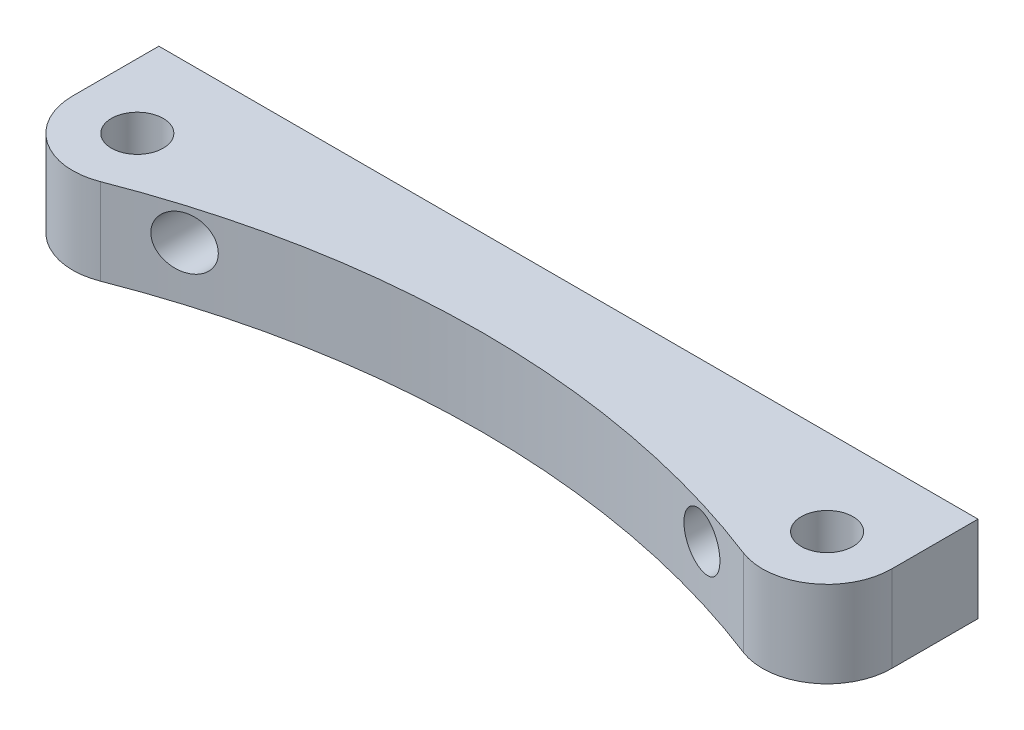
from build123d import *

# Parameters (mm, degrees)
SKETCH1_R           = 1.905
BOSS_EXTRUDE1_DEPTH = 6.35
CUT_EXTRUDE1_REACH  = 59.018
SKETCH2_R           = 1.905


with BuildPart() as part:
    # Sketch1 → Boss-Extrude1 (new body)
    with BuildSketch(Plane(origin=(0, 0, 0), x_dir=(1, 0, 0), z_dir=(0, 1, 0))):
        with BuildLine():
            Line((-4.7625, 6.35), (-4.7625, 0))
            ThreePointArc((-4.7625, 0), (-2.689307148, -3.930525832), (1.725283019, -4.439009434))
            ThreePointArc((1.725283019, -4.439009434), (25.4, 0), (49.074716981, -4.439009434))
            ThreePointArc((49.074716981, -4.439009434), (53.489307148, -3.930525832), (55.5625, 0))
            Line((55.5625, 0), (55.5625, 6.35))
            Line((55.5625, 6.35), (-4.7625, 6.35))
        make_face()
        Circle(SKETCH1_R, mode=Mode.SUBTRACT)
        with Locations((50.8, 0)):
            Circle(SKETCH1_R, mode=Mode.SUBTRACT)
    extrude(amount=BOSS_EXTRUDE1_DEPTH)

    # Sketch2 → Cut-Extrude1 (cut, up to next)
    with BuildSketch(Plane(origin=(0, 0, -6.35), x_dir=(-1, 0, 0), z_dir=(0, 0, -1)), mode=Mode.PRIVATE) as cut_extrude1_sk1:
        with Locations((-6.35, 3.96875)):
            Circle(SKETCH2_R)
    cut_extrude1_tool1 = extrude(cut_extrude1_sk1.sketch, amount=-CUT_EXTRUDE1_REACH, mode=Mode.PRIVATE) & part.part
    # Sketch2 → Cut-Extrude1 (cut, up to next)
    with BuildSketch(Plane(origin=(0, 0, -6.35), x_dir=(-1, 0, 0), z_dir=(0, 0, -1)), mode=Mode.PRIVATE) as cut_extrude1_sk2:
        with Locations((-44.45, 3.96875)):
            Circle(SKETCH2_R)
    cut_extrude1_tool2 = extrude(cut_extrude1_sk2.sketch, amount=-CUT_EXTRUDE1_REACH, mode=Mode.PRIVATE) & part.part
    add(cut_extrude1_tool1.solids().sort_by_distance((6.35, 3.96875, -6.35))[0], mode=Mode.SUBTRACT)
    add(cut_extrude1_tool2.solids().sort_by_distance((44.45, 3.96875, -6.35))[0], mode=Mode.SUBTRACT)


solid = part.part
